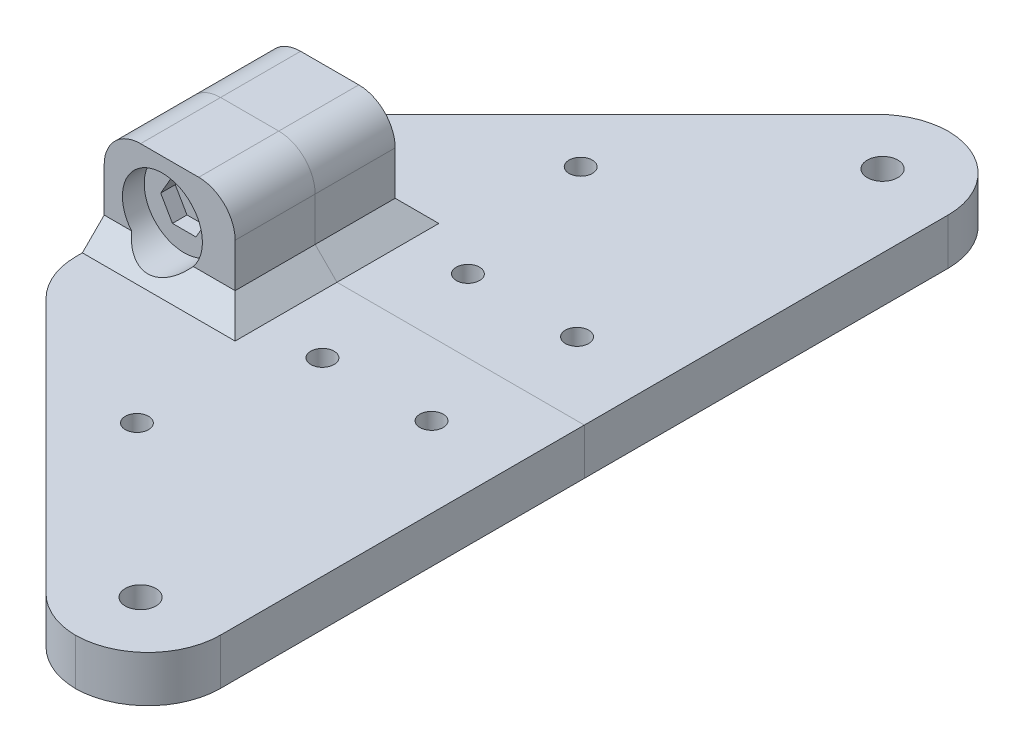
from build123d import *

# Parameters (mm, degrees)
SKETCH1_R           = 2.1
SKETCH1_R_2         = 1.6
BOSS_EXTRUDE1_DEPTH = 6.35
SKETCH2_W           = 18
SKETCH2_H           = 11
BOSS_EXTRUDE2_DEPTH = 14
SKETCH3_R           = 5.5
CUT_EXTRUDE1_DEPTH  = 3
CHAMFER1_SIZE       = 3
FILLET2_R           = 10
FILLET3_R           = 5
CUT_EXTRUDE2_DEPTH  = 2
SKETCH5_R           = 1.6
CUT_EXTRUDE3_DEPTH  = 2638.157111638
SKETCH6_R           = 2.95
CUT_EXTRUDE4_DEPTH  = 3


with BuildPart() as part:
    # Sketch1 → Boss-Extrude1 (new body)
    with BuildSketch(Plane(origin=(251.886129178, -2636.030473787, -0.277944786), x_dir=(1, 0, 0), z_dir=(0, 1, 0))):
        Polygon((-265.886129178, -0.277944786), (-251.886129178, -0.277944786), (-251.886129178, 59.722055214), (-306.886129178, 59.722055214), (-306.886129178, 40.722055214), align=None)
        with Locations(Location((-261.886129178, 8.722055214, 0), (0, 0, 270))):
            Circle(SKETCH1_R, mode=Mode.SUBTRACT)
        with Locations(Location((-282.886129178, 29.222055214, 0), (0, 0, 270))):
            Circle(SKETCH1_R_2, mode=Mode.SUBTRACT)
        with Locations(Location((-262.886129178, 49.722055214, 0), (0, 0, 270))):
            Circle(SKETCH1_R_2, mode=Mode.SUBTRACT)
        with Locations(Location((-277.886129178, 49.722055214, 0), (0, 0, 270))):
            Circle(SKETCH1_R_2, mode=Mode.SUBTRACT)
    extrude(amount=BOSS_EXTRUDE1_DEPTH)

    # Sketch2 → Boss-Extrude2 (add)
    with BuildSketch(Plane(origin=(-55, -2629.680473787, -60), x_dir=(1, 0, 0), z_dir=(0, -1, 0))):
        with Locations((9, 5.5)):
            Rectangle(SKETCH2_W, SKETCH2_H)
    extrude(amount=-BOSS_EXTRUDE2_DEPTH)

    # Sketch3 → Cut-Extrude1 (cut)
    with BuildSketch(Plane.XY.offset(-49)):
        with Locations((-47, -2623.180473787)):
            Circle(SKETCH3_R)
    extrude(amount=-CUT_EXTRUDE1_DEPTH, mode=Mode.SUBTRACT)

    # Chamfer1
    # the kernel refuses this chamfer: 3 mm, written as the material it adds along each edge
    with BuildSketch(Plane(origin=(-37, -2629.680473787, -49), x_dir=(0, -0.02749587661065579, 0.9996219169112949), z_dir=(-1, 0, 0))) as chamfer1_piece_1_section:
        Polygon((CHAMFER1_SIZE * 0.999621916911, CHAMFER1_SIZE * 0.0274958766107), (-CHAMFER1_SIZE * 0.0274958766107, CHAMFER1_SIZE * 0.999621916911), (0, 0), align=None)
    chamfer1_piece_1 = extrude(amount=18, mode=Mode.PRIVATE)
    chamfer1_piece_1 = chamfer1_piece_1 - Plane(origin=(-47, -2623.180473787, -47.945016367), x_dir=(1, 0, 0), z_dir=(0, 0, 1)) * Cylinder(5.5, 48, mode=Mode.PRIVATE)
    add(chamfer1_piece_1)
    with BuildSketch(Plane(origin=(-37, -2629.680473787, -60), x_dir=(0.9996219169112948, -0.027495876610655785, 0), z_dir=(0, 0, 1))) as chamfer1_piece_2:
        Polygon((CHAMFER1_SIZE * 0.999621916911, CHAMFER1_SIZE * 0.0274958766107), (-CHAMFER1_SIZE * 0.0274958766107, CHAMFER1_SIZE * 0.999621916911), (0, 0), align=None)
    extrude(amount=11)
    with BuildSketch(Plane(origin=(-29.284951036, -2629.680473787, -49), x_dir=(0, -0.02749587661065579, 0.9996219169112949), z_dir=(-1, 0, 0))) as chamfer1_piece_3a_section:
        Polygon((CHAMFER1_SIZE * 0.999621916911, CHAMFER1_SIZE * 0.0274958766107), (-CHAMFER1_SIZE * 0.0274958766107, CHAMFER1_SIZE * 0.999621916911), (0, 0), align=None)
    chamfer1_piece_3a = extrude(amount=25.715048964, mode=Mode.PRIVATE)
    chamfer1_piece_3a = split(chamfer1_piece_3a, bisect_by=Plane(origin=(-37, -2628.691092907, -48.01061912), z_dir=(1, 0, 0)), keep=Keep.TOP, mode=Mode.PRIVATE)
    with BuildSketch(Plane(origin=(-37, -2629.680473787, -60), x_dir=(0.9996219169112948, -0.027495876610655785, 0), z_dir=(0, 0, 1))) as chamfer1_piece_3b_section:
        Polygon((CHAMFER1_SIZE * 0.999621916911, CHAMFER1_SIZE * 0.0274958766107), (-CHAMFER1_SIZE * 0.0274958766107, CHAMFER1_SIZE * 0.999621916911), (0, 0), align=None)
    chamfer1_piece_3b = extrude(amount=18.715048964, mode=Mode.PRIVATE)
    chamfer1_piece_3b = split(chamfer1_piece_3b, bisect_by=Plane(origin=(-36.01061912, -2628.691092907, -49), z_dir=(0, 0, 1)), keep=Keep.TOP, mode=Mode.PRIVATE)
    chamfer1_piece_3 = chamfer1_piece_3a & chamfer1_piece_3b
    add(chamfer1_piece_3)

    # Fillet2
    # the kernel refuses this fillet: 10 mm, written as the material it takes off along each edge
    with BuildSketch(Plane(origin=(-14, -2646.385812847, 0), x_dir=(1, 0, 0), z_dir=(0, 1, 0)), Plane(origin=(-55, -2646.385812847, -41), x_dir=(0.7071067811865518, 0, 0.7071067811865432), z_dir=(0, 1, 0))) as fillet2_piece_1:
        with BuildLine():
            CenterArc((FILLET2_R * 0.414213562373, FILLET2_R), FILLET2_R, 225, 45)
            Line((-FILLET2_R * 0.292893218813, FILLET2_R * 0.292893218813), (0, 0))
            Line((0, 0), (FILLET2_R * 0.414213562373, 0))
        make_face()
    extrude(amount=27.060678119, mode=Mode.SUBTRACT)
    with BuildSketch(Plane(origin=(0, -2661.030473787, 0), x_dir=(0, 0, -1), z_dir=(0, 1, 0))) as fillet2_piece_2:
        with BuildLine():
            CenterArc((FILLET2_R, FILLET2_R), FILLET2_R, 180, 90)
            Line((0, FILLET2_R), (0, 0))
            Line((0, 0), (FILLET2_R, 0))
        make_face()
    extrude(amount=56.35, mode=Mode.SUBTRACT)

    # Fillet3
    fillet3_edges = [part.edges().sort_by_distance(p)[0] for p in [
        (-37, -2615.680473787, -54.5),
        (-55, -2615.680473787, -54.5),
    ]]
    fillet(fillet3_edges, radius=FILLET3_R)

    # Sketch4 → Cut-Extrude2 (cut)
    with BuildSketch(Plane.XY.offset(-52)):
        Polygon((-45.383419246, -2625.980473787), (-43.766838493, -2623.180473787), (-45.383419246, -2620.380473787), (-48.616580754, -2620.380473787), (-50.233161507, -2623.180473787), (-48.616580754, -2625.980473787), align=None)
    extrude(amount=-CUT_EXTRUDE2_DEPTH, mode=Mode.SUBTRACT)

    # Sketch5 → Cut-Extrude3 (cut, through all)
    with BuildSketch(Plane.XY.offset(-54)):
        with Locations((-47, -2623.180473787)):
            Circle(SKETCH5_R)
    extrude(amount=-CUT_EXTRUDE3_DEPTH, mode=Mode.SUBTRACT)

    # Sketch6 → Cut-Extrude4 (cut)
    with BuildSketch(Plane(origin=(0, 0, -60), x_dir=(-1, 0, 0), z_dir=(0, 0, -1))):
        with Locations((47, -2623.180473787)):
            Circle(SKETCH6_R)
    extrude(amount=-CUT_EXTRUDE4_DEPTH, mode=Mode.SUBTRACT)


with BuildPart() as body_2:
    # Mirror2: mirrored copy
    add(part.part.mirror(Plane(origin=(0, -2629.680473787, -60), x_dir=(1, 0, 0), z_dir=(0, 0, 1))))


solid = Compound([part.part, body_2.part])
